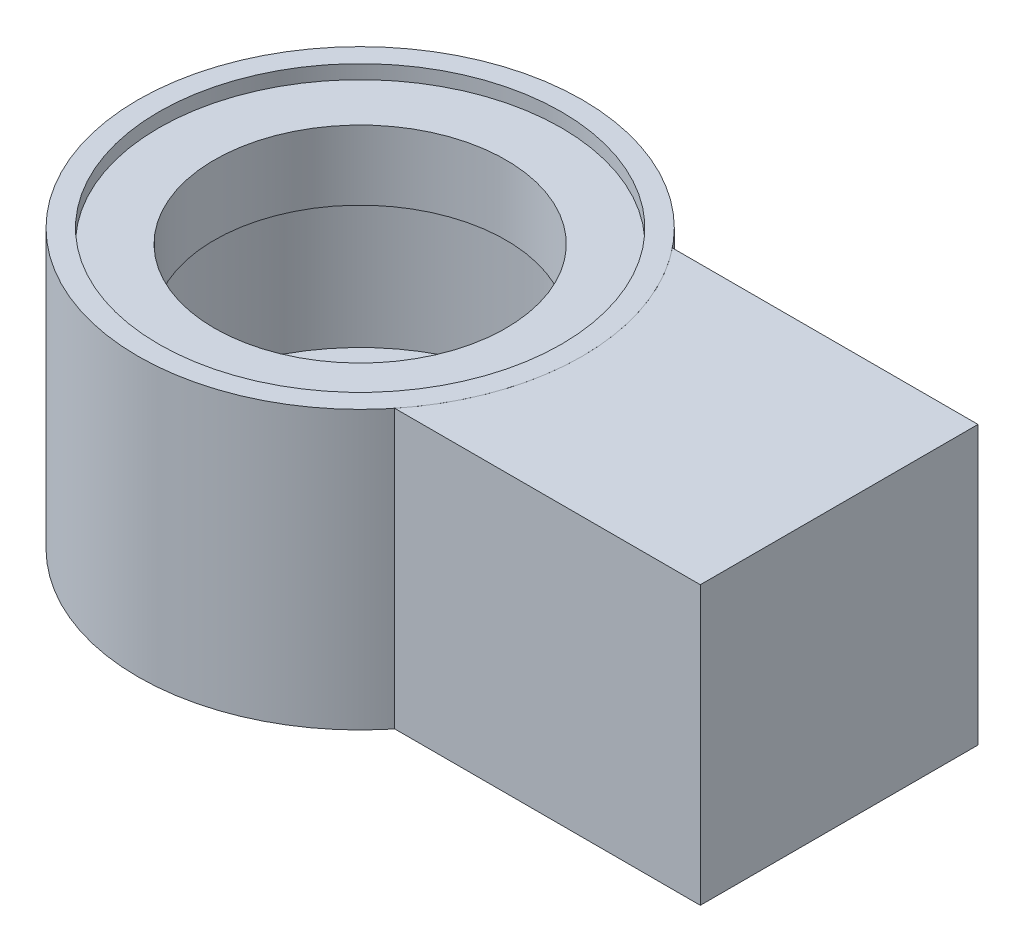
from build123d import *

# Parameters (mm, degrees)
SKETCH10_W                            = 101.6
SKETCH10_H                            = 101.6
BOSS_EXTRUDE11_DEPTH                  = 93.98
BOSS_EXTRUDE11_DIRECTION_2_REACH      = 218.958
BOSS_EXTRUDE11_DIRECTION_2_END_RADIUS = 81.28


with BuildPart() as part:
    # Sketch1 → Revolve3 (revolve)
    with BuildSketch(Plane(origin=(0, 0, 0), x_dir=(0, 0, -1), z_dir=(1, 0, 0))):
        Polygon((-60.96, 101.6), (-60.96, 0), (0, 0), (0, 10.16), (-22.86, 10.16), (-22.86, 15.24), (-48.26, 15.24), (-48.26, 71.12), (-33.02, 71.12), (-33.02, 96.52), (-53.34, 96.52), (-53.34, 101.6), align=None)
    revolve(axis=Axis((0, 101.6, -20.32), (0, -1, 0)))


with BuildPart() as body_2:
    # Sketch10 → Boss-Extrude11 (new body)
    with BuildSketch(Plane(origin=(81.28, 0, 0), x_dir=(0, 0, -1), z_dir=(1, 0, 0))):
        with Locations((20.32, 50.8)):
            Rectangle(SKETCH10_W, SKETCH10_H)
    extrude(amount=BOSS_EXTRUDE11_DEPTH)

    # Boss-Extrude11 direction 2: up to this cylinder (the profile starts outside it)
    boss_extrude11_direction_2_end = Plane(origin=(0, 50.8, -20.32), z_dir=(0, 1, 0)) * Cylinder(BOSS_EXTRUDE11_DIRECTION_2_END_RADIUS, 601.476, mode=Mode.PRIVATE)
    # Sketch10 → Boss-Extrude11 direction 2 (add, up to the surface)
    with BuildSketch(Plane(origin=(81.28, 0, 0), x_dir=(0, 0, -1), z_dir=(1, 0, 0)), mode=Mode.PRIVATE) as boss_extrude11_direction_2_sk1:
        with Locations((20.32, 50.8)):
            Rectangle(SKETCH10_W, SKETCH10_H)
    boss_extrude11_direction_2_tool1 = extrude(boss_extrude11_direction_2_sk1.sketch, amount=-BOSS_EXTRUDE11_DIRECTION_2_REACH, mode=Mode.PRIVATE) - boss_extrude11_direction_2_end
    add(boss_extrude11_direction_2_tool1.solids().sort_by_distance((81.28, 50.8, -20.32))[0])
    add(boss_extrude11_direction_2_tool1.solids().sort_by_distance((81.28, 50.8, -20.32))[1])


solid = Compound([part.part, body_2.part])
